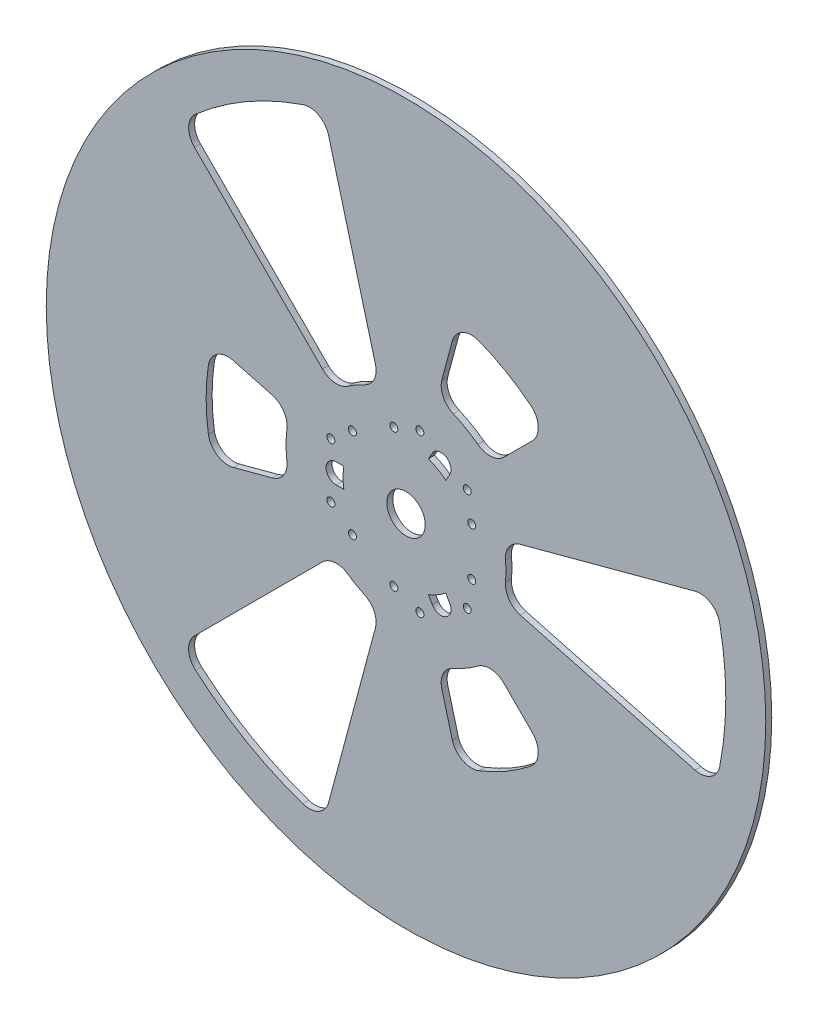
from build123d import *

# Parameters (mm, degrees)
SKETCH1_R           = 180
SKETCH1_R_2         = 2
SKETCH1_R_3         = 9.6
BOSS_EXTRUDE1_DEPTH = 3


with BuildPart() as part:
    # Sketch1 → Boss-Extrude1 (new body)
    with BuildSketch(Plane.XY):
        Circle(SKETCH1_R)
        with Locations((-37.587704831, 13.680805733)):
            Circle(SKETCH1_R_2, mode=Mode.SUBTRACT)
        with Locations((-37.587704831, -13.680805733)):
            Circle(SKETCH1_R_2, mode=Mode.SUBTRACT)
        with Locations((6.945927107, 39.39231012)):
            Circle(SKETCH1_R_2, mode=Mode.SUBTRACT)
        with Locations((6.945927107, -39.39231012)):
            Circle(SKETCH1_R_2, mode=Mode.SUBTRACT)
        with Locations((30.641777725, -25.711504387)):
            Circle(SKETCH1_R_2, mode=Mode.SUBTRACT)
        with Locations((30.641777725, 25.711504387)):
            Circle(SKETCH1_R_2, mode=Mode.SUBTRACT)
        Circle(SKETCH1_R_3, mode=Mode.SUBTRACT)
        with Locations((-26.811555509, 22.497566339)):
            Circle(SKETCH1_R_2, mode=Mode.SUBTRACT)
        with Locations((-6.077686218, -34.468271355)):
            Circle(SKETCH1_R_2, mode=Mode.SUBTRACT)
        with Locations((-26.811555509, -22.497566339)):
            Circle(SKETCH1_R_2, mode=Mode.SUBTRACT)
        with Locations((-6.077686218, 34.468271355)):
            Circle(SKETCH1_R_2, mode=Mode.SUBTRACT)
        with Locations((32.889241728, 11.970705016)):
            Circle(SKETCH1_R_2, mode=Mode.SUBTRACT)
        with Locations((32.889241728, -11.970705016)):
            Circle(SKETCH1_R_2, mode=Mode.SUBTRACT)
        with BuildLine():
            Line((13.169872981, 32.810889132), (11.220194521, 29.433946981))
            ThreePointArc((11.220194521, 29.433946981), (15.75, 27.279800219), (19.880448559, 24.433946981))
            Line((19.880448559, 24.433946981), (21.830127019, 27.810889132))
            ThreePointArc((21.830127019, 27.810889132), (20, 34.641016151), (13.169872981, 32.810889132))
        make_face(mode=Mode.SUBTRACT)
        with BuildLine():
            Line((-35, -5), (-31.10064308, -5))
            ThreePointArc((-31.10064308, -5), (-31.5, 0), (-31.10064308, 5))
            Line((-31.10064308, 5), (-35, 5))
            ThreePointArc((-35, 5), (-40, 0), (-35, -5))
        make_face(mode=Mode.SUBTRACT)
        with BuildLine():
            Line((13.169872981, -32.810889132), (11.220194521, -29.433946981))
            ThreePointArc((11.220194521, -29.433946981), (15.75, -27.279800219), (19.880448559, -24.433946981))
            Line((19.880448559, -24.433946981), (21.830127019, -27.810889132))
            ThreePointArc((21.830127019, -27.810889132), (20, -34.641016151), (13.169872981, -32.810889132))
        make_face(mode=Mode.SUBTRACT)
        with BuildLine():
            Line((-15.311941202, -57.144942529), (-38.736487678, -144.56654012))
            ThreePointArc((-38.736487678, -144.56654012), (-43.687363408, -150.800545197), (-51.622129003, -151.443572981))
            ThreePointArc((-51.622129003, -151.443572981), (-80, -138.564064606), (-105.342916939, -120.427861605))
            ThreePointArc((-105.342916939, -120.427861605), (-108.753421341, -113.234639134), (-105.830052443, -105.830052443))
            Line((-105.830052443, -105.830052443), (-41.833001327, -41.833001327))
            ThreePointArc((-41.833001327, -41.833001327), (-35.598196118, -38.939097244), (-28.968277929, -40.753390949))
            ThreePointArc((-28.968277929, -40.753390949), (-25, -43.301270189), (-20.809332888, -45.463960065))
            ThreePointArc((-20.809332888, -45.463960065), (-15.923149355, -50.298490789), (-15.311941202, -57.144942529))
        make_face(mode=Mode.SUBTRACT)
        with BuildLine():
            Line((57.144942529, 15.311941202), (144.56654012, 38.736487678))
            ThreePointArc((144.56654012, 38.736487678), (152.440784749, 37.565906063), (156.965045943, 31.015711376))
            ThreePointArc((156.965045943, 31.015711376), (160, 0), (156.965045943, -31.015711376))
            ThreePointArc((156.965045943, -31.015711376), (152.440784749, -37.565906063), (144.56654012, -38.736487678))
            Line((144.56654012, -38.736487678), (57.144942529, -15.311941202))
            ThreePointArc((57.144942529, -15.311941202), (51.521345473, -11.359393545), (49.777610817, -4.710569116))
            ThreePointArc((49.777610817, -4.710569116), (50, 0), (49.777610817, 4.710569116))
            ThreePointArc((49.777610817, 4.710569116), (51.521345473, 11.359393545), (57.144942529, 15.311941202))
        make_face(mode=Mode.SUBTRACT)
        with BuildLine():
            Line((-66.921304299, 17.931509443), (-86.395032352, 23.149479149))
            ThreePointArc((-86.395032352, 23.149479149), (-94.457348532, 21.858849657), (-98.870247559, 14.989134318))
            ThreePointArc((-98.870247559, 14.989134318), (-100, 0), (-98.870247559, -14.989134318))
            ThreePointArc((-98.870247559, -14.989134318), (-94.457348532, -21.858849657), (-86.395032352, -23.149479149))
            Line((-86.395032352, -23.149479149), (-66.921304299, -17.931509443))
            ThreePointArc((-66.921304299, -17.931509443), (-61.229537792, -13.879595719), (-59.579566929, -7.090501012))
            ThreePointArc((-59.579566929, -7.090501012), (-60, 0), (-59.579566929, 7.090501012))
            ThreePointArc((-59.579566929, 7.090501012), (-61.229537792, 13.879595719), (-66.921304299, 17.931509443))
        make_face(mode=Mode.SUBTRACT)
        with BuildLine():
            Line((17.931509443, 66.921304299), (23.149479149, 86.395032352))
            ThreePointArc((23.149479149, 86.395032352), (28.298355166, 92.731888231), (36.45415268, 93.118713224))
            ThreePointArc((36.45415268, 93.118713224), (50, 86.602540378), (62.416094879, 78.129578906))
            ThreePointArc((62.416094879, 78.129578906), (66.158993366, 70.873038574), (63.245553203, 63.245553203))
            Line((63.245553203, 63.245553203), (48.989794856, 48.989794856))
            ThreePointArc((48.989794856, 48.989794856), (42.634851383, 46.08653733), (35.930337466, 48.052168001))
            ThreePointArc((35.930337466, 48.052168001), (30, 51.961524227), (23.649229463, 55.142669013))
            ThreePointArc((23.649229463, 55.142669013), (18.594686409, 59.96613305), (17.931509443, 66.921304299))
        make_face(mode=Mode.SUBTRACT)
        with BuildLine():
            Line((17.931509443, -66.921304299), (23.149479149, -86.395032352))
            ThreePointArc((23.149479149, -86.395032352), (28.298355166, -92.731888231), (36.45415268, -93.118713224))
            ThreePointArc((36.45415268, -93.118713224), (50, -86.602540378), (62.416094879, -78.129578906))
            ThreePointArc((62.416094879, -78.129578906), (66.158993366, -70.873038574), (63.245553203, -63.245553203))
            Line((63.245553203, -63.245553203), (48.989794856, -48.989794856))
            ThreePointArc((48.989794856, -48.989794856), (42.634851383, -46.08653733), (35.930337466, -48.052168001))
            ThreePointArc((35.930337466, -48.052168001), (30, -51.961524227), (23.649229463, -55.142669013))
            ThreePointArc((23.649229463, -55.142669013), (18.594686409, -59.96613305), (17.931509443, -66.921304299))
        make_face(mode=Mode.SUBTRACT)
        with BuildLine():
            Line((-41.833001327, 41.833001327), (-105.830052443, 105.830052443))
            ThreePointArc((-105.830052443, 105.830052443), (-108.753421341, 113.234639134), (-105.342916939, 120.427861605))
            ThreePointArc((-105.342916939, 120.427861605), (-80, 138.564064606), (-51.622129003, 151.443572981))
            ThreePointArc((-51.622129003, 151.443572981), (-43.687363408, 150.800545197), (-38.736487678, 144.56654012))
            Line((-38.736487678, 144.56654012), (-15.311941202, 57.144942529))
            ThreePointArc((-15.311941202, 57.144942529), (-15.923149355, 50.298490789), (-20.809332888, 45.463960065))
            ThreePointArc((-20.809332888, 45.463960065), (-25, 43.301270189), (-28.968277929, 40.753390949))
            ThreePointArc((-28.968277929, 40.753390949), (-35.598196118, 38.939097244), (-41.833001327, 41.833001327))
        make_face(mode=Mode.SUBTRACT)
    extrude(amount=BOSS_EXTRUDE1_DEPTH)


solid = part.part
